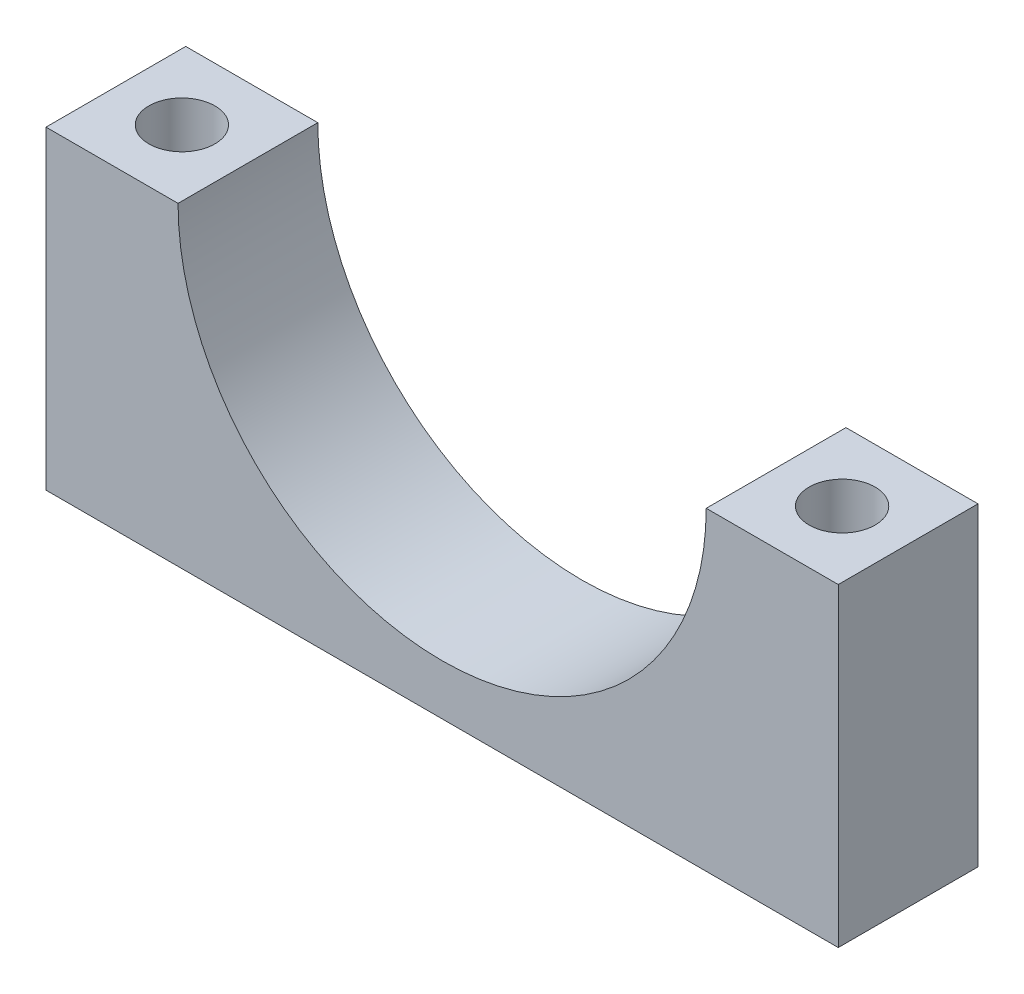
from build123d import *

# Parameters (mm, degrees)
BOSS_EXTRUDE1_DEPTH = 6.35
SKETCH5_R           = 1.5
CUT_EXTRUDE1_DEPTH  = 40.24863254


with BuildPart() as part:
    # Sketch4 → Boss-Extrude1 (new body)
    with BuildSketch(Plane.XY):
        with BuildLine():
            Line((30, 14.2875), (36, 14.2875))
            Line((36, 14.2875), (36, 0))
            Line((36, 0), (0, 0))
            Line((0, 0), (0, 14.2875))
            Line((0, 14.2875), (6, 14.2875))
            ThreePointArc((6, 14.2875), (18, 2.2875), (30, 14.2875))
        make_face()
    extrude(amount=BOSS_EXTRUDE1_DEPTH)

    # Sketch5 → Cut-Extrude1 (cut, through all)
    with BuildSketch(Plane(origin=(0, 14.2875, 0), x_dir=(1, 0, 0), z_dir=(0, 1, 0))):
        with Locations((3, -3.175)):
            Circle(SKETCH5_R)
        with Locations((33, -3.175)):
            Circle(SKETCH5_R)
    extrude(amount=-CUT_EXTRUDE1_DEPTH, mode=Mode.SUBTRACT)


solid = part.part
